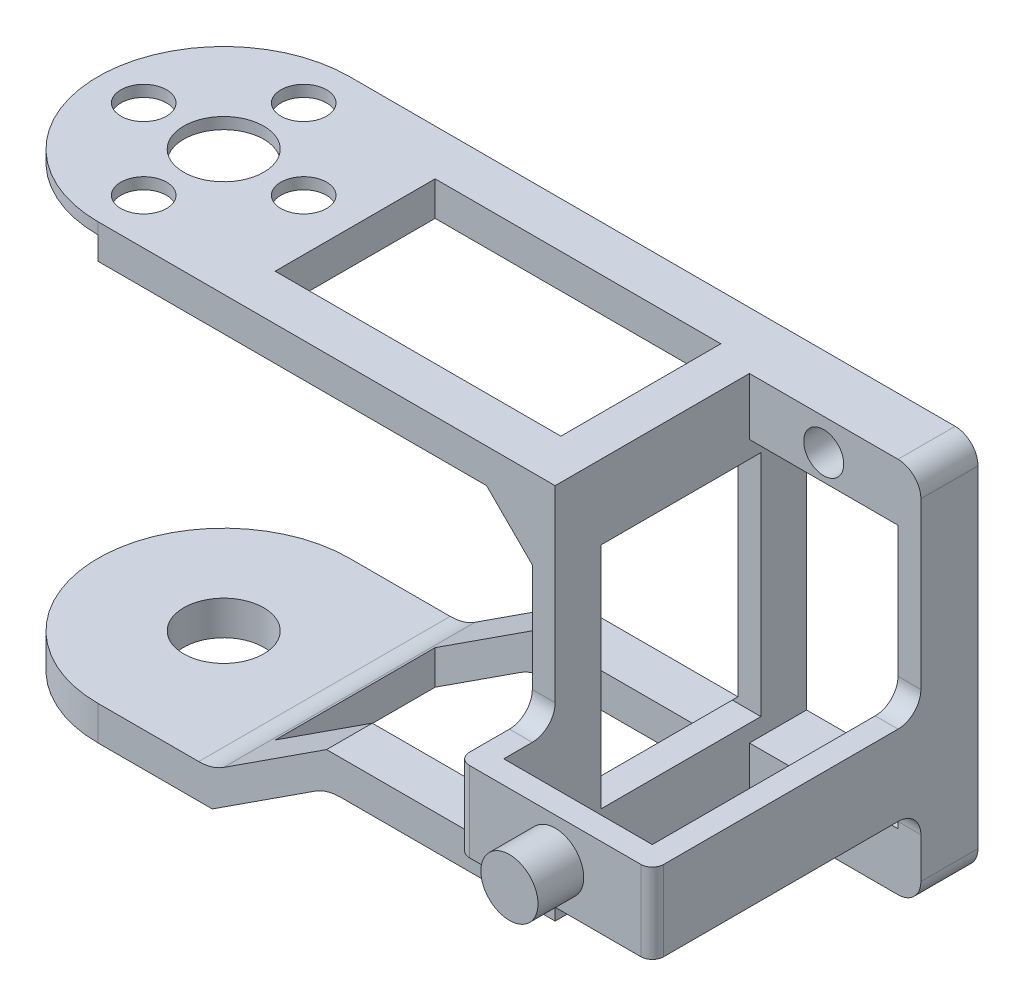
from build123d import *

# Parameters (mm, degrees)
EXTRUDE_1_DEPTH             = 3
SKETCH_3_R                  = 11
CUT_EXTRUDE_1_DEPTH         = 2
CUT_EXTRUDE_2_DEPTH         = 20
CUT_EXTRUDE_2_DEPTH_BACK    = 42.593268686
SKETCH_1_R                  = 3
SKETCH_1_R_2                = 2
EXTRUDE_2_DEPTH             = 3
SKETCH_5_R                  = 3.5
CUT_EXTRUDE_3_DEPTH         = 58.282196187
SKETCH_8_W                  = 20
SKETCH_8_H                  = 22
EXTRUDE_4_DEPTH             = 3
EXTRUDE_5_REACH             = 57.256
EXTRUDE_5_DIRECTION_2_REACH = 57.256
SKETCH_11_W                 = 5
SKETCH_11_H                 = 5
EXTRUDE_6_DEPTH             = 15
EXTRUDE_6_2_DEPTH           = 15
SKETCH_13_W                 = 2
SKETCH_13_H                 = 22
EXTRUDE_7_DEPTH             = 33
SKETCH_15_W                 = 2
SKETCH_15_H                 = 5
EXTRUDE_8_DEPTH             = 28
SKETCH_14_R                 = 1.75
CUT_EXTRUDE_4_DEPTH         = 69.163406605
SKETCH_16_W                 = 2
SKETCH_16_H                 = 7
EXTRUDE_9_DEPTH             = 6.5
SKETCH_17_W                 = 2
SKETCH_17_H                 = 7
EXTRUDE_10_DEPTH            = 15
SKETCH_18_W                 = 2
SKETCH_18_H                 = 7
EXTRUDE_11_DEPTH            = 21.5
SKETCH_19_R                 = 2.5
EXTRUDE_12_DEPTH            = 4
CUT_EXTRUDE_5_REACH         = 66.773
SKETCH_20_W                 = 14
SKETCH_20_H                 = 20
SKETCH_21_W                 = 25
SKETCH_21_H                 = 14
CUT_EXTRUDE_6_DEPTH         = 72.045759902
CHAMFER_1_SIZE              = 4
FILLET_1_R                  = 4
FILLET_2_R                  = 2
FILLET_3_R                  = 2
FILLET_4_R                  = 1


with BuildPart() as part:
    # 草图2 → 凸台-拉伸1 (new body)
    with BuildSketch(Plane(origin=(0, 0, 0), x_dir=(1, 0, 0), z_dir=(0, 1, 0))):
        with BuildLine():
            Line((0, 11), (40, 11))
            Line((40, 11), (40, -11))
            Line((40, -11), (0, -11))
            ThreePointArc((0, -11), (-11, 0), (0, 11))
        make_face()
    extrude(amount=EXTRUDE_1_DEPTH)

    # 草图3 → 切除-拉伸1 (cut)
    with BuildSketch(Plane(origin=(0, 0, 0), x_dir=(-1, 0, 0), z_dir=(0, -1, 0))):
        Circle(SKETCH_3_R)
    extrude(amount=-CUT_EXTRUDE_1_DEPTH, mode=Mode.SUBTRACT)

    # 草图1 → 切除-拉伸2 (cut, two sides: drawn at the far end of the back side and taken through both)
    with BuildSketch(Plane(origin=(0, 0, 0), x_dir=(1, 0, 0), z_dir=(0, 1, 0)).offset(-CUT_EXTRUDE_2_DEPTH_BACK)):
        with Locations(Location((0, 0, 0), (0, 0, 90))):
            Circle(SKETCH_1_R)
        with Locations(Location((-7, 0, 0), (0, 0, 90))):
            Circle(SKETCH_1_R_2)
        with Locations(Location((0, 7, 0), (0, 0, 90))):
            Circle(SKETCH_1_R_2)
        with Locations(Location((7, 0, 0), (0, 0, 90))):
            Circle(SKETCH_1_R_2)
        with Locations(Location((0, -7, 0), (0, 0, 90))):
            Circle(SKETCH_1_R_2)
    extrude(amount=CUT_EXTRUDE_2_DEPTH + CUT_EXTRUDE_2_DEPTH_BACK, mode=Mode.SUBTRACT)


with BuildPart() as body_2:
    # 草图4 → 凸台-拉伸2 (new body)
    with BuildSketch(Plane(origin=(0, -33.5, 0), x_dir=(-1, 0, 0), z_dir=(0, -1, 0))):
        with BuildLine():
            Line((0, 11), (-10, 11))
            Line((-10, 11), (-10, -11))
            Line((-10, -11), (0, -11))
            ThreePointArc((0, -11), (11, 0), (0, 11))
        make_face()
    extrude(amount=EXTRUDE_2_DEPTH)


with BuildPart() as cut_extrude_3_tool:
    # 草图5 → 切除-拉伸3 (new, through all)
    with BuildSketch(Plane(origin=(0, -36.5, 0), x_dir=(-1, 0, 0), z_dir=(0, -1, 0))):
        with Locations(Location((0, 0, 0), (0, 0, 180))):
            Circle(SKETCH_5_R)
    extrude(amount=-CUT_EXTRUDE_3_DEPTH)


with BuildPart() as part_1:
    add(part.part)

    # 切除-拉伸3: cut by cut_extrude_3_tool
    add(cut_extrude_3_tool.part, mode=Mode.SUBTRACT)



with BuildPart() as body_2_1:
    add(body_2.part)

    # 切除-拉伸3: cut by cut_extrude_3_tool
    add(cut_extrude_3_tool.part, mode=Mode.SUBTRACT)


with BuildPart() as body_3:
    # 草图8 → 凸台-拉伸4 (new body)
    with BuildSketch(Plane(origin=(0, -27, 0), x_dir=(-1, 0, 0), z_dir=(0, -1, 0))):
        with Locations((-30, 0)):
            Rectangle(SKETCH_8_W, SKETCH_8_H)
    extrude(amount=EXTRUDE_4_DEPTH)

    # 凸台-拉伸5: up to this face of the body (flat: up to its plane)
    extrude_5_end = Plane(body_3.part.faces().sort_by_distance((30, -28.5, 11))[0])
    # 草图10 → 凸台-拉伸5 (add, up to the picked face)
    with BuildSketch(Plane.XY, mode=Mode.PRIVATE) as extrude_5_sk1:
        Polygon((10, -36.5), (20, -30), (20, -27), (10, -33.5), align=None)
    extrude_5_tool1 = split(extrude(extrude_5_sk1.sketch, amount=EXTRUDE_5_REACH, mode=Mode.PRIVATE), bisect_by=extrude_5_end, keep=Keep.BOTH, mode=Mode.PRIVATE)

    add(body_2_1.part)  # 凸台-拉伸5 merges body 2
    add(extrude_5_tool1.solids().sort_by(Axis((15, -31.75, 0), (0, 0, 1)))[0])

    # 凸台-拉伸5 direction 2: up to this face of the body (flat: up to its plane)
    extrude_5_direction_2_end = Plane(body_3.part.faces().sort_by_distance((30, -28.5, -11))[0])
    # 草图10 → 凸台-拉伸5 direction 2 (add, up to the picked face)
    with BuildSketch(Plane.XY, mode=Mode.PRIVATE) as extrude_5_direction_2_sk1:
        Polygon((10, -36.5), (20, -30), (20, -27), (10, -33.5), align=None)
    extrude_5_direction_2_tool1 = split(extrude(extrude_5_direction_2_sk1.sketch, amount=-EXTRUDE_5_DIRECTION_2_REACH, mode=Mode.PRIVATE), bisect_by=extrude_5_direction_2_end, keep=Keep.BOTH, mode=Mode.PRIVATE)
    add(extrude_5_direction_2_tool1.solids().sort_by(Axis((15, -31.75, 0), (0, 0, -1)))[0])


with BuildPart() as body_3_2:
    # 草图11 → 凸台-拉伸6 (new body)
    with BuildSketch(Plane(origin=(40, 0, 0), x_dir=(0, 0, -1), z_dir=(1, 0, 0))):
        with Locations((8.5, 0.5)):
            Rectangle(SKETCH_11_W, SKETCH_11_H)
    extrude(amount=EXTRUDE_6_DEPTH)


with BuildPart() as body_4:
    # 草图11 → Extrude 6 2 (new body)
    with BuildSketch(Plane(origin=(40, 0, 0), x_dir=(0, 0, -1), z_dir=(1, 0, 0))):
        with Locations((8.5, -27.5)):
            Rectangle(SKETCH_11_W, SKETCH_11_H)
    extrude(amount=EXTRUDE_6_2_DEPTH)


with BuildPart() as part_2:
    add(part_1.part)

    add(body_3.part)  # 凸台-拉伸7 merges body 3

    add(body_3_2.part)  # 凸台-拉伸7 merges body 3 2

    add(body_4.part)  # 凸台-拉伸7 merges body 4
    # 草图13 → 凸台-拉伸7 (add)
    with BuildSketch(Plane(origin=(0, 3, 0), x_dir=(1, 0, 0), z_dir=(0, 1, 0))):
        with Locations((39, 0)):
            Rectangle(SKETCH_13_W, SKETCH_13_H)
    extrude(amount=-EXTRUDE_7_DEPTH)

    # 草图15 → 凸台-拉伸8 (add)
    with BuildSketch(Plane.XZ.offset(2)):
        with Locations((54, -8.5)):
            Rectangle(SKETCH_15_W, SKETCH_15_H)
    extrude(amount=EXTRUDE_8_DEPTH)

    # 草图14 → 切除-拉伸4 (cut, through all)
    with BuildSketch(Plane.XY.offset(-6)):
        with Locations((46.5, 0.25)):
            Circle(SKETCH_14_R)
        with Locations(Location((46.5, -27.25, 0), (0, 0, 180))):
            Circle(SKETCH_14_R)
    extrude(amount=-CUT_EXTRUDE_4_DEPTH, mode=Mode.SUBTRACT)

    # 草图16 → 凸台-拉伸9 (add)
    with BuildSketch(Plane.XY.offset(11)):
        with Locations((39, -18.95)):
            Rectangle(SKETCH_16_W, SKETCH_16_H)
    extrude(amount=EXTRUDE_9_DEPTH)

    # 草图17 → 凸台-拉伸10 (add)
    with BuildSketch(Plane(origin=(40, 0, 0), x_dir=(0, 0, -1), z_dir=(1, 0, 0))):
        with Locations((-16.5, -18.95)):
            Rectangle(SKETCH_17_W, SKETCH_17_H)
    extrude(amount=EXTRUDE_10_DEPTH)

    # 草图18 → 凸台-拉伸11 (add)
    with BuildSketch(Plane(origin=(0, 0, 15.5), x_dir=(-1, 0, 0), z_dir=(0, 0, -1))):
        with Locations((-54, -18.95)):
            Rectangle(SKETCH_18_W, SKETCH_18_H)
    extrude(amount=EXTRUDE_11_DEPTH)

    # 草图19 → 凸台-拉伸12 (add)
    with BuildSketch(Plane.XY.offset(17.5)):
        with Locations((46.5, -18.95)):
            Circle(SKETCH_19_R)
    extrude(amount=EXTRUDE_12_DEPTH)

    # 草图20 → 切除-拉伸5 (cut, up to next)
    with BuildSketch(Plane.ZY.offset(-38), mode=Mode.PRIVATE) as cut_extrude_5_sk1:
        with Locations((0, -13.5)):
            Rectangle(SKETCH_20_W, SKETCH_20_H)
    cut_extrude_5_tool1 = extrude(cut_extrude_5_sk1.sketch, amount=-CUT_EXTRUDE_5_REACH, mode=Mode.PRIVATE) & part_2.part
    add(cut_extrude_5_tool1.solids().sort_by_distance((38, -13.5, 0))[0], mode=Mode.SUBTRACT)

    # 草图21 → 切除-拉伸6 (cut, through all)
    with BuildSketch(Plane(origin=(0, 3, 0), x_dir=(1, 0, 0), z_dir=(0, 1, 0))):
        with Locations((24, 0)):
            Rectangle(SKETCH_21_W, SKETCH_21_H)
    extrude(amount=-CUT_EXTRUDE_6_DEPTH, mode=Mode.SUBTRACT)

    # 倒角1
    # the kernel refuses this chamfer: 4 mm, written as the material it adds along each edge
    with BuildSketch(Plane(origin=(38, -27, -11), x_dir=(-0.999621916911297, -0.027495876610579655, 0), z_dir=(0, 0, 1))) as chamfer_1_piece_1_section:
        Polygon((CHAMFER_1_SIZE * 0.999621916911, -CHAMFER_1_SIZE * 0.0274958766106), (-CHAMFER_1_SIZE * 0.0274958766106, -CHAMFER_1_SIZE * 0.999621916911), (0, 0), align=None)
    chamfer_1_piece_1 = extrude(amount=32.286731952, mode=Mode.PRIVATE)
    chamfer_1_piece_1 = split(chamfer_1_piece_1, bisect_by=Plane(origin=(35.666666667, -26.166666667, -7), z_dir=(0, 0, -1)), keep=Keep.TOP, mode=Mode.PRIVATE)
    add(chamfer_1_piece_1)
    with BuildSketch(Plane(origin=(38, -27, -11), x_dir=(-0.999621916911297, -0.027495876610579655, 0), z_dir=(0, 0, 1))) as chamfer_1_piece_2_section:
        Polygon((CHAMFER_1_SIZE * 0.999621916911, -CHAMFER_1_SIZE * 0.0274958766106), (-CHAMFER_1_SIZE * 0.0274958766106, -CHAMFER_1_SIZE * 0.999621916911), (0, 0), align=None)
    chamfer_1_piece_2 = extrude(amount=22, mode=Mode.PRIVATE)
    chamfer_1_piece_2 = split(chamfer_1_piece_2, bisect_by=Plane(origin=(36.5, -25.399122807, 0), z_dir=(1, 0, 0)), keep=Keep.TOP, mode=Mode.PRIVATE)
    chamfer_1_piece_2 = split(chamfer_1_piece_2, bisect_by=Plane(origin=(37.293859649, -23.5, 0), z_dir=(0, -1, 0)), keep=Keep.TOP, mode=Mode.PRIVATE)
    add(chamfer_1_piece_2)
    with BuildSketch(Plane(origin=(38, -27, -21.286731952), x_dir=(-0.999621916911297, -0.02749587661057961, 0), z_dir=(0, 0, 1))) as chamfer_1_piece_3_section:
        Polygon((CHAMFER_1_SIZE * 0.999621916911, -CHAMFER_1_SIZE * 0.0274958766106), (-CHAMFER_1_SIZE * 0.0274958766106, -CHAMFER_1_SIZE * 0.999621916911), (0, 0), align=None)
    chamfer_1_piece_3 = extrude(amount=32.286731952, mode=Mode.PRIVATE)
    chamfer_1_piece_3 = split(chamfer_1_piece_3, bisect_by=Plane(origin=(35.666666667, -26.166666667, 7), z_dir=(0, 0, 1)), keep=Keep.TOP, mode=Mode.PRIVATE)
    add(chamfer_1_piece_3)
    with BuildSketch(Plane(origin=(38, 0, 11), x_dir=(0.02749587661058563, -0.9996219169112968, 0), z_dir=(0, 0, -1))) as chamfer_1_piece_4_section:
        Polygon((CHAMFER_1_SIZE * 0.999621916911, CHAMFER_1_SIZE * 0.0274958766106), (-CHAMFER_1_SIZE * 0.0274958766106, CHAMFER_1_SIZE * 0.999621916911), (0, 0), align=None)
    chamfer_1_piece_4 = extrude(amount=32.286731952, mode=Mode.PRIVATE)
    chamfer_1_piece_4 = split(chamfer_1_piece_4, bisect_by=Plane(origin=(37.833333333, -3.666666667, 7), z_dir=(0, 0, 1)), keep=Keep.TOP, mode=Mode.PRIVATE)
    add(chamfer_1_piece_4)
    with BuildSketch(Plane(origin=(38, 0, 21.286731952), x_dir=(0.02749587661058563, -0.9996219169112968, 0), z_dir=(0, 0, -1))) as chamfer_1_piece_5_section:
        Polygon((CHAMFER_1_SIZE * 0.999621916911, CHAMFER_1_SIZE * 0.0274958766106), (-CHAMFER_1_SIZE * 0.0274958766106, CHAMFER_1_SIZE * 0.999621916911), (0, 0), align=None)
    chamfer_1_piece_5 = extrude(amount=32.286731952, mode=Mode.PRIVATE)
    chamfer_1_piece_5 = split(chamfer_1_piece_5, bisect_by=Plane(origin=(37.293859649, -1.600877193, 7), z_dir=(0, 0, -1)), keep=Keep.TOP, mode=Mode.PRIVATE)
    chamfer_1_piece_5 = split(chamfer_1_piece_5, bisect_by=Plane(origin=(37.293859649, -3.5, 0), z_dir=(0, 1, 0)), keep=Keep.TOP, mode=Mode.PRIVATE)
    chamfer_1_piece_5 = split(chamfer_1_piece_5, bisect_by=Plane(origin=(36.5, -1.600877193, 0), z_dir=(1, 0, 0)), keep=Keep.TOP, mode=Mode.PRIVATE)
    add(chamfer_1_piece_5)
    with BuildSketch(Plane(origin=(38, 0, 21.286731952), x_dir=(0.02749587661058563, -0.9996219169112968, 0), z_dir=(0, 0, -1))) as chamfer_1_piece_6_section:
        Polygon((CHAMFER_1_SIZE * 0.999621916911, CHAMFER_1_SIZE * 0.0274958766106), (-CHAMFER_1_SIZE * 0.0274958766106, CHAMFER_1_SIZE * 0.999621916911), (0, 0), align=None)
    chamfer_1_piece_6 = extrude(amount=32.286731952, mode=Mode.PRIVATE)
    chamfer_1_piece_6 = split(chamfer_1_piece_6, bisect_by=Plane(origin=(37.833333333, -3.666666667, -7), z_dir=(0, 0, -1)), keep=Keep.TOP, mode=Mode.PRIVATE)
    add(chamfer_1_piece_6)

    # 圆角1
    fillet_1_edges = [part_2.edges().sort_by_distance(p)[0] for p in [
        (20, -30, -9),
        (10, -33.5, 0),
        (20, -30, 9),
    ]]
    fillet(fillet_1_edges, radius=FILLET_1_R)

    # 圆角2
    fillet_2_edges = [part_2.edges().sort_by_distance(p)[0] for p in [
        (55, 3, -8.5),
        (55, -30, -8.5),
    ]]
    fillet(fillet_2_edges, radius=FILLET_2_R)

    # 圆角3
    fillet_3_edges = [part_2.edges().sort_by_distance(p)[0] for p in [
        (39, -22.45, 11),
        (39, -15.45, 11),
        (54, -15.45, -6),
        (54, -22.45, -6),
    ]]
    fillet(fillet_3_edges, radius=FILLET_3_R)

    # 圆角4
    fillet_4_edges = [part_2.edges().sort_by_distance(p)[0] for p in [
        (38, -18.95, 17.5),
        (55, -18.95, 17.5),
    ]]
    fillet(fillet_4_edges, radius=FILLET_4_R)


solid = part_2.part
